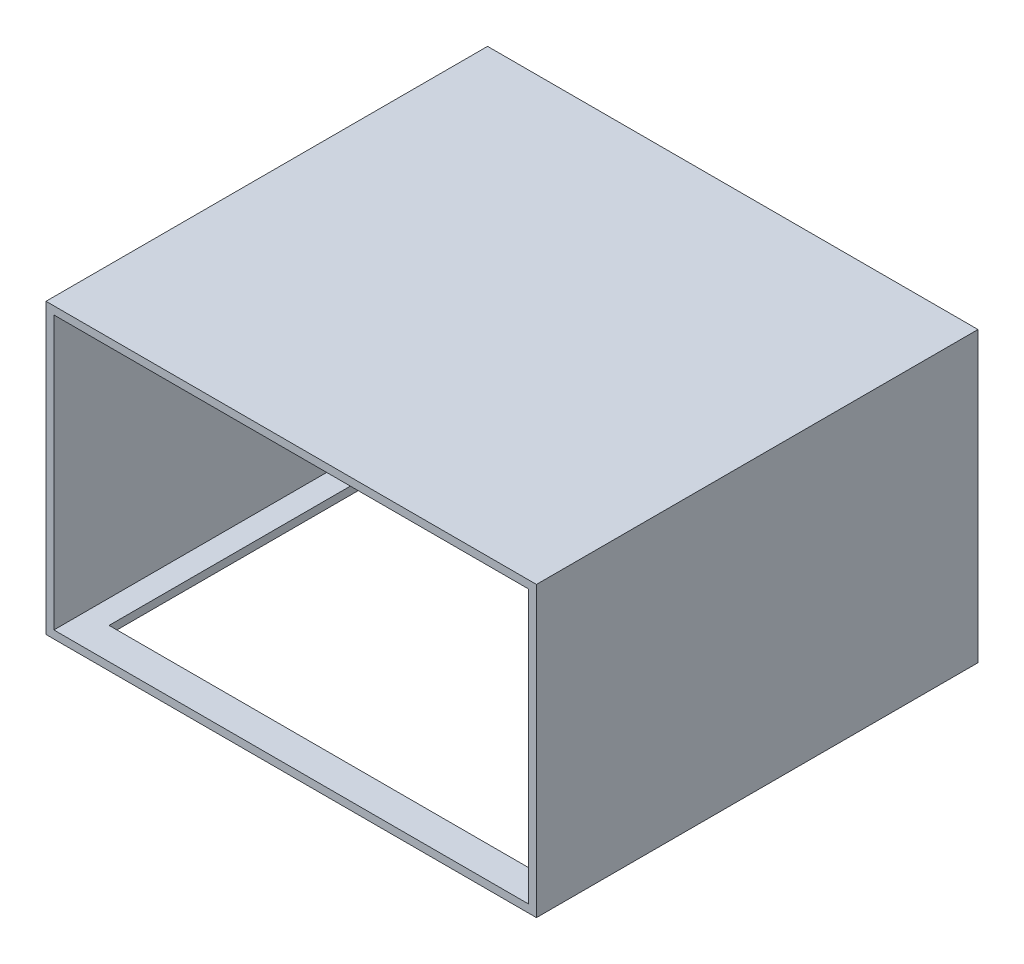
from build123d import *

# Parameters (mm, degrees)
SKETCH1_W             = 2.5
SKETCH1_H             = 140
BOSS_EXTRUDE1_DEPTH   = 86.5
BOSS_EXTRUDE1_2_DEPTH = 86.5
SKETCH2_W             = 155.5
SKETCH2_H             = 140
BOSS_EXTRUDE2_DEPTH   = 2.5
SKETCH3_W             = 155.5
SKETCH3_H             = 140
SKETCH3_W_2           = 135.5
SKETCH3_H_2           = 120
BOSS_EXTRUDE3_DEPTH   = 2.5


with BuildPart() as part:
    # Sketch1 → Boss-Extrude1 (new body)
    with BuildSketch(Plane(origin=(0, 0, 0), x_dir=(1, 0, 0), z_dir=(0, 1, 0))):
        with Locations((-16.235321917, 55.323341548)):
            Rectangle(SKETCH1_W, SKETCH1_H)
    extrude(amount=BOSS_EXTRUDE1_DEPTH)



with BuildPart() as body_2:
    # Sketch1 → Boss-Extrude1 2 (new body)
    with BuildSketch(Plane(origin=(0, 0, 0), x_dir=(1, 0, 0), z_dir=(0, 1, 0))):
        with Locations((136.764678083, 55.323341548)):
            Rectangle(SKETCH1_W, SKETCH1_H)
    extrude(amount=BOSS_EXTRUDE1_2_DEPTH)


with BuildPart() as part_1:
    add(part.part)

    add(body_2.part)  # Boss-Extrude2 merges body 2
    # Sketch2 → Boss-Extrude2 (add)
    with BuildSketch(Plane(origin=(0, 86.5, 0), x_dir=(1, 0, 0), z_dir=(0, 1, 0))):
        with Locations((60.264678083, 55.323341548)):
            Rectangle(SKETCH2_W, SKETCH2_H)
    extrude(amount=BOSS_EXTRUDE2_DEPTH)

    # Sketch3 → Boss-Extrude3 (add)
    with BuildSketch(Plane(origin=(0, 0, 0), x_dir=(1, 0, 0), z_dir=(0, 1, 0))):
        with Locations((60.264678083, 55.323341548)):
            Rectangle(SKETCH3_W, SKETCH3_H)
        with Locations((60.264678083, 55.323341548)):
            Rectangle(SKETCH3_W_2, SKETCH3_H_2, mode=Mode.SUBTRACT)
    extrude(amount=-BOSS_EXTRUDE3_DEPTH)


solid = part_1.part
